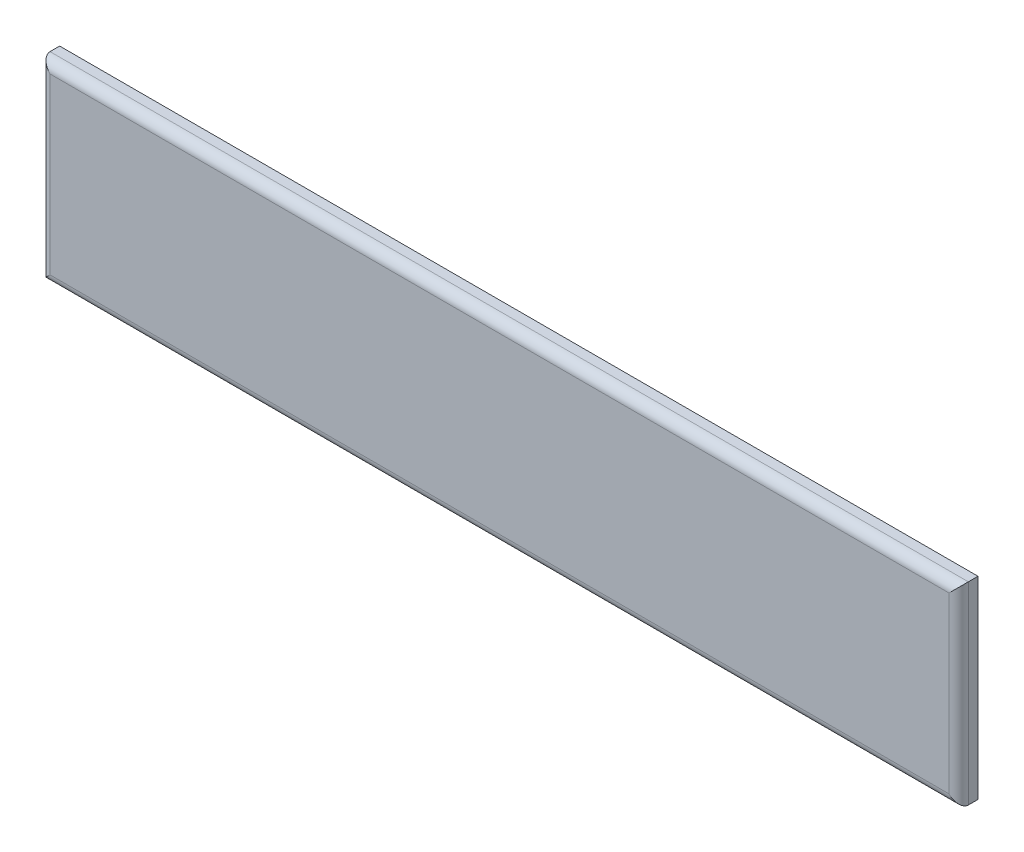
from build123d import *

# Parameters (mm, degrees)
SKETCH1_W                      = 95
SKETCH1_H                      = 20
BOSS_EXTRUDE1_DEPTH            = 1
FILLET1_R                      = 1
F_1_0MM_DOWEL_HOLE1_AT_2_COUNT = 2
F_1_0MM_DOWEL_HOLE1_AT_2_PITCH = 4
F_1_0MM_DOWEL_HOLE1_AT_3_COUNT = 2
F_1_0MM_DOWEL_HOLE1_AT_3_PITCH = 84
F_1_0MM_DOWEL_HOLE1_AT_4_COUNT = 2
F_1_0MM_DOWEL_HOLE1_AT_4_PITCH = 88
F_1_0MM_DOWEL_HOLE2_AT_2_COUNT = 2
F_1_0MM_DOWEL_HOLE2_AT_2_PITCH = 3.4


with BuildPart() as part:
    # Sketch1 → Boss-Extrude1 (new, symmetric)
    with BuildSketch(Plane.XY):
        Rectangle(SKETCH1_W, SKETCH1_H)
    extrude(amount=BOSS_EXTRUDE1_DEPTH, both=True)

    # Fillet1
    fillet1_edges = [part.edges().sort_by_distance(p)[0] for p in [
        (-47.5, 0, 1),
        (0, -10, 1),
        (47.5, 0, 1),
        (0, 10, 1),
    ]]
    fillet(fillet1_edges, radius=FILLET1_R)

    # Sketch3 → Ø1.0mm Dowel Hole1 (revolve, cut)
    with BuildSketch(Plane(origin=(44, -8, -1), x_dir=(0, 1, 0), z_dir=(1, 0, 0))):
        Polygon((0, 0), (0, 1.150215155), (0.25, 1), (0.25, 0), align=None)
    f_1_0mm_dowel_hole1 = revolve(axis=Axis((44, -8, -7.35), (0, 0, 1)), mode=Mode.SUBTRACT)

    # Ø1.0mm Dowel Hole1 at 2: Ø1.0mm Dowel Hole1 ×2
    with Locations(*[(-i * F_1_0MM_DOWEL_HOLE1_AT_2_PITCH, 0, 0) for i in range(1, F_1_0MM_DOWEL_HOLE1_AT_2_COUNT)]):
        add(f_1_0mm_dowel_hole1, mode=Mode.SUBTRACT)

    # Ø1.0mm Dowel Hole1 at 3: Ø1.0mm Dowel Hole1 ×2
    with Locations(*[(-i * F_1_0MM_DOWEL_HOLE1_AT_3_PITCH, 0, 0) for i in range(1, F_1_0MM_DOWEL_HOLE1_AT_3_COUNT)]):
        add(f_1_0mm_dowel_hole1, mode=Mode.SUBTRACT)

    # Ø1.0mm Dowel Hole1 at 4: Ø1.0mm Dowel Hole1 ×2
    with Locations(*[(-i * F_1_0MM_DOWEL_HOLE1_AT_4_PITCH, 0, 0) for i in range(1, F_1_0MM_DOWEL_HOLE1_AT_4_COUNT)]):
        add(f_1_0mm_dowel_hole1, mode=Mode.SUBTRACT)

    # Mirror1: Ø1.0mm Dowel Hole1 across plane
    add(f_1_0mm_dowel_hole1.mirror(Plane.ZX), mode=Mode.SUBTRACT)

    # Mirror1 copy 1 sketch → Mirror1 copy 1 (revolve, cut)
    with BuildSketch(Plane(origin=(40, 8, -1), x_dir=(0, -1, 0), z_dir=(1, 0, 0))):
        Polygon((0, 0), (0, -1.150215155), (0.25, -1), (0.25, 0), align=None)
    revolve(axis=Axis((40, 8, -7.35), (0, 0, -1)), mode=Mode.SUBTRACT)

    # Mirror1 copy 2 sketch → Mirror1 copy 2 (revolve, cut)
    with BuildSketch(Plane(origin=(-40, 8, -1), x_dir=(0, -1, 0), z_dir=(1, 0, 0))):
        Polygon((0, 0), (0, -1.150215155), (0.25, -1), (0.25, 0), align=None)
    revolve(axis=Axis((-40, 8, -7.35), (0, 0, -1)), mode=Mode.SUBTRACT)

    # Mirror1 copy 3 sketch → Mirror1 copy 3 (revolve, cut)
    with BuildSketch(Plane(origin=(-44, 8, -1), x_dir=(0, -1, 0), z_dir=(1, 0, 0))):
        Polygon((0, 0), (0, -1.150215155), (0.25, -1), (0.25, 0), align=None)
    revolve(axis=Axis((-44, 8, -7.35), (0, 0, -1)), mode=Mode.SUBTRACT)

    # Sketch5 → Ø1.0mm Dowel Hole2 (revolve, cut)
    with BuildSketch(Plane(origin=(46.8, 0, -1), x_dir=(0, 1, 0), z_dir=(1, 0, 0))):
        Polygon((0, 0), (0, 1.150215155), (0.25, 1), (0.25, 0), align=None)
    f_1_0mm_dowel_hole2 = revolve(axis=Axis((46.8, 0, -7.35), (0, 0, 1)), mode=Mode.SUBTRACT)

    # Ø1.0mm Dowel Hole2 at 2: Ø1.0mm Dowel Hole2 ×2
    with Locations(*[(-i * F_1_0MM_DOWEL_HOLE2_AT_2_PITCH, 0, 0) for i in range(1, F_1_0MM_DOWEL_HOLE2_AT_2_COUNT)]):
        add(f_1_0mm_dowel_hole2, mode=Mode.SUBTRACT)

    # Mirror2: Ø1.0mm Dowel Hole2 across plane
    add(f_1_0mm_dowel_hole2.mirror(Plane(origin=(0, 0, 0), x_dir=(0, 0, 1), z_dir=(1, 0, 0))), mode=Mode.SUBTRACT)

    # Mirror2 copy 1 sketch → Mirror2 copy 1 (revolve, cut)
    with BuildSketch(Plane(origin=(-43.4, 0, -1), x_dir=(0, 1, 0), z_dir=(-1, 0, 0))):
        Polygon((0, 0), (0, -1.150215155), (0.25, -1), (0.25, 0), align=None)
    revolve(axis=Axis((-43.4, 0, -7.35), (0, 0, -1)), mode=Mode.SUBTRACT)


solid = part.part
